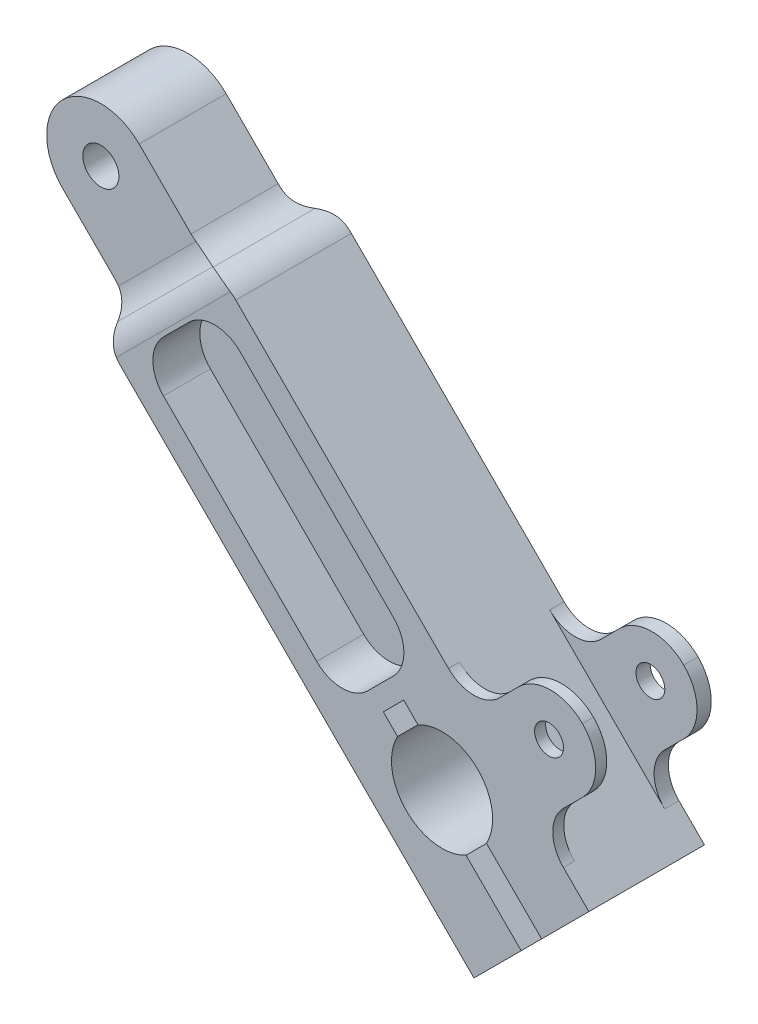
from build123d import *

# Parameters (mm, degrees)
BOSS_EXTRUDE1_DEPTH    = 38
SKETCH2_3_R            = 3.9999999999999627
BOSS_EXTRUDE2_DEPTH    = 6.5
FILLET1_R              = 12.5
FILLET1_OF_MIRROR1_R   = 12.5
BOSS_EXTRUDE3_DEPTH    = 45
SKETCH4_R              = 5.000000000000005
CUT_EXTRUDE1_DEPTH     = 231.17837570940728
CUT_EXTRUDE8_START     = -0.897
CUT_EXTRUDE8_DEPTH     = 0.897
FILLET2_R              = 15
FILLET3_R              = 10
SKETCH8_R              = 3.9999999999999964
SKETCH8_R_2            = 4
CUT_EXTRUDE4_DEPTH     = 10
CUT_EXTRUDE5_START     = -2.5515
CUT_EXTRUDE5_OUTLINE_R = 4
CUT_EXTRUDE5_DEPTH     = 2.5515
CUT_EXTRUDE6_START     = -3.4485
CUT_EXTRUDE6_OUTLINE_R = 4
CUT_EXTRUDE6_DEPTH     = 3.4485
CUT_EXTRUDE7_DEPTH     = 13
FILLET4_R              = 10
FILLET6_R              = 10
FILLET7_R              = 10
FILLET4_OF_MIRROR2_R   = 10
THREAD1_PITCH          = 1
THREAD2_PITCH          = 1


with BuildPart() as part:
    # Sketch2 → Boss-Extrude1 (new body)
    with BuildSketch(Plane.XY):
        with BuildLine():
            ThreePointArc((131.93651427858003, -126.27966002908764), (129.52074910994037, -109.72175923671702), (112.96284831756975, -107.30599406807737))
            Line((112.96284831756975, -107.30599406807737), (109.01465245553005, -103.35779820603764))
            Line((109.01465245553005, -103.35779820603764), (103.35779820603757, -109.01465245552998))
            Line((103.35779820603757, -109.01465245552998), (107.30599406807737, -112.96284831756975))
            ThreePointArc((107.30599406807737, -112.96284831756975), (109.72175923671703, -129.52074910994037), (126.27966002908764, -131.93651427858003))
            Line((126.27966002908764, -131.93651427858003), (141.5415643901112, -147.1984186396036))
            Line((141.5415643901112, -147.1984186396036), (128.46008893816008, -160.27989409155472))
            Line((128.46008893816008, -160.27989409155472), (114.31795331442913, -146.13775846782377))
            Line((114.31795331442913, -146.13775846782377), (26.51650429449548, -58.336309447890216))
            Line((26.51650429449548, -58.336309447890216), (31.819805153394636, -53.03300858899105))
            Line((31.819805153394636, -53.03300858899105), (53.03300858899106, -31.819805153394636))
            Line((53.03300858899106, -31.819805153394636), (58.3363094478902, -26.516504294495466))
            Line((58.3363094478902, -26.516504294495466), (128.4600889381601, -96.64028378476549))
            Line((128.4600889381601, -96.64028378476549), (146.13775846782377, -114.31795331442913))
            Line((146.13775846782377, -114.31795331442913), (160.27989409155475, -128.46008893816008))
            Line((160.27989409155475, -128.46008893816008), (147.1984186396036, -141.5415643901112))
            Line((147.1984186396036, -141.5415643901112), (131.93651427858003, -126.27966002908764))
        make_face()
    extrude(amount=BOSS_EXTRUDE1_DEPTH)

    # Sketch2<3> → Boss-Extrude2 (add)
    with BuildSketch(Plane.XY):
        Polygon((149.67329237375654, -75.42708034916903), (128.4600889381601, -96.64028378476549), (146.13775846782377, -114.31795331442913), (167.35096190342023, -93.10474987883272), align=None)
        with Locations(Location((149.25239548019323, -92.68385298526943, 0), (0, 0, 180))):
            Circle(SKETCH2_3_R, mode=Mode.SUBTRACT)
    boss_extrude2 = extrude(amount=BOSS_EXTRUDE2_DEPTH)

    # Fillet1
    fillet1_edges = [part.edges().sort_by_distance(p)[0] for p in [
        (167.35096190342023, -93.10474987883272, 3.25),
        (149.67329237375654, -75.42708034916903, 3.25),
    ]]
    fillet(fillet1_edges, radius=FILLET1_R - 0.0001)  # a hair under: the kernel refuses the full size

    # Mirror1: Boss-Extrude2 across plane
    add(boss_extrude2.mirror(Plane(origin=(0, 0, 19), x_dir=(1, 0, 0), z_dir=(0, 0, -1))))

    # Fillet1 of Mirror1
    fillet1_of_mirror1_edges = [part.edges().sort_by_distance(p)[0] for p in [
        (167.35096190342023, -93.10474987883272, 34.75),
        (149.67329237375654, -75.42708034916903, 34.75),
    ]]
    fillet(fillet1_of_mirror1_edges, radius=FILLET1_OF_MIRROR1_R - 0.0001)  # a hair under: the kernel refuses the full size

    # Sketch3 → Boss-Extrude3 (add)
    with BuildSketch(Plane(origin=(42.42640687119298, -42.426406871192754, 0), x_dir=(0, 0, 1), z_dir=(-0.7071067811865493, 0.7071067811865457, 0))):
        Polygon((6.499999999999996, 14.99999999999999), (31.499999999999993, 14.99999999999999), (31.5, -15.00000000000001), (6.499999999999999, -15.00000000000001), align=None)
    extrude(amount=BOSS_EXTRUDE3_DEPTH)

    # Sketch4 → Cut-Extrude1 (cut, through all)
    with BuildSketch(Plane.XY.offset(31.499999999999993)):
        with Locations((21.213203435596462, -21.213203435596423)):
            Circle(SKETCH4_R)
    extrude(amount=-CUT_EXTRUDE1_DEPTH, mode=Mode.SUBTRACT)

    # Sketch12 → Cut-Extrude8 (cut)
    with BuildSketch(Plane.XY.offset(31.499999999999993).offset(CUT_EXTRUDE8_START)):
        Polygon((31.819805153394782, -53.03300858899101), (53.033008588991144, -31.819805153394533), (21.21320343559643, 2.26e-14), (6.424e-14, -21.21320343559645), align=None)
    extrude(amount=CUT_EXTRUDE8_DEPTH, mode=Mode.SUBTRACT)

    # Fillet2
    fillet2_edges = [part.edges().sort_by_distance(p)[0] for p in [
        (21.213203435596437, 3.375e-14, 18.551499999999994),
        (6.75e-14, -21.213203435596448, 18.551499999999997),
    ]]
    fillet(fillet2_edges, radius=FILLET2_R - 0.0001)  # a hair under: the kernel refuses the full size

    # Fillet3
    fillet3_edges = [part.edges().sort_by_distance(p)[0] for p in [
        (128.4600889381601, -96.64028378476549, 3.25),
        (146.13775846782377, -114.31795331442913, 3.25),
        (128.4600889381601, -96.64028378476549, 34.75),
        (146.13775846782377, -114.31795331442913, 34.75),
    ]]
    fillet(fillet3_edges, radius=FILLET3_R)

    # Sketch8 → Cut-Extrude4 (cut)
    with BuildSketch(Plane(origin=(-15.909902576697377, -15.909902576697391, 0), x_dir=(0, 0, 1), z_dir=(-0.7071067811865472, -0.7071067811865479, 0))):
        with Locations(Location((20.591500000000007, -151.0189999999996, 0), (0, 0, 270))):
            Circle(SKETCH8_R)
        with Locations(Location((20.591500000000003, -192.16999999999985, 0), (0, 0, 270))):
            Circle(SKETCH8_R_2)
    extrude(amount=-CUT_EXTRUDE4_DEPTH, mode=Mode.SUBTRACT)

    # Cut-Extrude5: read off the stored shape, not the designer's step
    # Cut-Extrude5 outline → Cut-Extrude5 (cut)
    with BuildSketch(Plane(origin=(0, 0, 0), x_dir=(-1, 0, 0), z_dir=(0, 0, -1)).offset(CUT_EXTRUDE5_START)):
        Polygon((-184.134167706, -104.605815324), (-128.460088938, -160.279894092), (-26.516504294, -58.336309448), (-82.190583062, -2.66223068), align=None)
        with Locations((-149.25239548, -92.683852985)):
            Circle(CUT_EXTRUDE5_OUTLINE_R, mode=Mode.SUBTRACT)
    extrude(amount=CUT_EXTRUDE5_DEPTH, mode=Mode.SUBTRACT)

    # Cut-Extrude6: read off the stored shape, not the designer's step
    # Cut-Extrude6 outline → Cut-Extrude6 (cut)
    with BuildSketch(Plane.XY.offset(38).offset(CUT_EXTRUDE6_START)):
        Polygon((26.516504294, -58.336309448), (128.460088938, -160.279894092), (184.009996871, -104.729986159), (82.066412227, -2.786401515), align=None)
        with Locations((149.25239548, -92.683852985)):
            Circle(CUT_EXTRUDE6_OUTLINE_R, mode=Mode.SUBTRACT)
    extrude(amount=CUT_EXTRUDE6_DEPTH, mode=Mode.SUBTRACT)

    # Sketch11 → Cut-Extrude7 (cut)
    with BuildSketch(Plane(origin=(0, 0, 2.551500000000005), x_dir=(-1, 0, -2e-17), z_dir=(2e-17, -1.3e-16, -1))):
        Polygon((-113.19718906624851, -91.98398563065189), (-102.59058734845024, -102.59058734845023), (-99.0550534425175, -99.05505344251749), (-109.66165516031576, -88.44845172471916), align=None)
        Polygon((-99.0550534425175, -99.05505344251749), (-102.59058734845024, -102.59058734845023), (-91.98398563065216, -113.19718906624838), (-88.44845172471943, -109.66165516031565), align=None)
        Polygon((-109.66165516031576, -88.44845172471916), (-99.0550534425175, -99.05505344251749), (-74.30631610098834, -74.30631610098833), (-49.557578759459176, -49.557578759459176), (-60.164180477257275, -38.950977041661005), align=None)
        Polygon((-74.30631610098834, -74.30631610098833), (-99.0550534425175, -99.05505344251749), (-88.44845172471943, -109.66165516031565), (-63.699714383190155, -84.91291781878655), align=None)
        Polygon((-49.557578759459176, -49.557578759459176), (-74.30631610098834, -74.30631610098833), (-63.69971438319015, -84.91291781878657), (-38.950977041660906, -60.164180477257496), align=None)
        Polygon((-60.164180477257275, -38.950977041661005), (-49.55757875945917, -49.557578759459176), (-46.02204485352645, -46.022044853526445), (-56.62864657132452, -35.415443135728296), align=None)
        Polygon((-46.02204485352645, -46.022044853526445), (-49.557578759459176, -49.557578759459176), (-38.950977041660906, -60.164180477257496), (-35.41544313572817, -56.62864657132479), align=None)
    cut_extrude7 = extrude(amount=-CUT_EXTRUDE7_DEPTH, mode=Mode.SUBTRACT)

    # Fillet4
    fillet4_edges = [part.edges().sort_by_distance(p)[0] for p in [
        (35.41544313572817, -56.62864657132479, 9.051500000000013),
        (91.98398563065216, -113.19718906624838, 9.051500000000022),
        (113.19718906624851, -91.98398563065189, 9.051500000000019),
        (56.62864657132452, -35.415443135728296, 9.051500000000011),
    ]]
    fillet(fillet4_edges, radius=FILLET4_R)

    # Fillet6
    # the kernel refuses this fillet: 10 mm, written as the material it adds along each edge
    with BuildSketch(Plane(origin=(53.03300858899116, -31.81980515339452, 6.4999999999999964), x_dir=(0.7071067811865468, 0.7071067811865482, 0), z_dir=(0, 0, 1))) as fillet6_piece_1:
        with BuildLine():
            CenterArc((9.999999999999986, 9.682458365518524), FILLET6_R, 180.00000000000014, 75.52248781406956)
            Line((-1.534e-14, 9.682458365518503), (-0.2000000000000149, 9.682458365518503))
            Line((-0.2000000000000149, 9.682458365518503), (-0.1999999999999996, 2.1e-16))
            Line((-0.1999999999999996, 2.1e-16), (-2e-16, -0.1999999999999996))
            ThreePointArc((-2e-16, -0.1999999999999996), (3.749999999999965, -0.19999999999998838), (7.449999999999917, -0.19364916731037407))
            Line((7.449999999999917, -0.19364916731037407), (7.499999999999917, -1.1e-16))
        make_face()
    extrude(amount=24.102999999999998)
    with BuildSketch(Plane(origin=(31.819805153394785, -53.033008588991, 30.602999999999994), x_dir=(-4.884542673953227e-11, 4.884542673953201e-11, 1.0), z_dir=(0.7071067811865457, 0.7071067811865495, 0))) as fillet6_piece_2:
        with BuildLine():
            CenterArc((10.000000000549937, -7.96111472994481), FILLET6_R, 127.2396365377071, 52.76036346625074)
            Line((5.4993681e-10, -7.961114730635589), (-0.19999999945006247, -7.961114730649404))
            Line((-0.19999999945006247, -7.961114730649404), (-0.1999999999999993, -1.381557e-11))
            Line((-0.1999999999999993, -1.381557e-11), (-1.381557e-11, 0.19999999999999962))
            ThreePointArc((-1.381557e-11, 0.19999999999999962), (1.9742499999861822, 0.2000000001363364), (3.8274699999890065, 0.1592222945988919))
            Line((3.8274699999890065, 0.1592222945988919), (3.948500000000003, 0))
        make_face()
    extrude(amount=30)
    with BuildSketch(Plane(origin=(31.81980515339479, -53.033008588991, 6.499999999999999), x_dir=(-4.884461071493019e-11, 4.884444323840101e-11, -1.0), z_dir=(0.7071067811865457, 0.7071067811865493, 0))) as fillet6_piece_3:
        with BuildLine():
            CenterArc((10.000000000549926, 7.961114729944808), FILLET6_R, 179.99999999604222, 52.76036346625068)
            Line((5.4992668e-10, 7.961114730635574), (-0.1999999994500735, 7.961114730649389))
            Line((-0.1999999994500735, 7.961114730649389), (-0.20000000000000018, 1.381532e-11))
            Line((-0.20000000000000018, 1.381532e-11), (-1.381532e-11, -0.1999999999999996))
            ThreePointArc((-1.381532e-11, -0.1999999999999996), (1.9742499999861833, -0.20000000013633387), (3.827469999988999, -0.15922229459889203))
            Line((3.827469999988999, -0.15922229459889203), (3.9484999999999975, 0))
        make_face()
    extrude(amount=30)
    with BuildSketch(Plane(origin=(31.81980515339479, -53.033008588991, 30.602999999999994), x_dir=(-0.7071067811865537, -0.7071067811865414, 0), z_dir=(0, 0, -1))) as fillet6_piece_4:
        with BuildLine():
            CenterArc((10.000000000000112, 9.68245836551857), FILLET6_R, 179.99999999999937, 75.52248781407133)
            Line((1.0969e-13, 9.682458365518684), (-0.19999999999988977, 9.682458365518686))
            Line((-0.19999999999988977, 9.682458365518686), (-0.1999999999999996, 1.74e-15))
            Line((-0.1999999999999996, 1.74e-15), (-1.74e-15, -0.19999999999999962))
            ThreePointArc((-1.74e-15, -0.19999999999999962), (3.7500000000001013, -0.1999999999999594), (7.450000000000217, -0.19364916731037085))
            Line((7.450000000000217, -0.19364916731037085), (7.500000000000217, -2.3e-16))
        make_face()
    extrude(amount=24.102999999999994)
    with BuildSketch(Plane(origin=(31.81980515339479, -53.033008588991, 6.499999999999999), x_dir=(-4.884461071493019e-11, 4.884444323840101e-11, -1.0), z_dir=(0.7071067811865457, 0.7071067811865493, 0))) as fillet6_piece_5a_section:
        with BuildLine():
            CenterArc((10.000000000549926, 7.961114729944808), FILLET6_R, 179.99999999604222, 52.76036346625068)
            Line((5.4992668e-10, 7.961114730635574), (-0.1999999994500735, 7.961114730649389))
            Line((-0.1999999994500735, 7.961114730649389), (-0.20000000000000018, 1.381532e-11))
            Line((-0.20000000000000018, 1.381532e-11), (-1.381532e-11, -0.1999999999999996))
            ThreePointArc((-1.381532e-11, -0.1999999999999996), (1.9742499999861833, -0.20000000013633387), (3.827469999988999, -0.15922229459889203))
            Line((3.827469999988999, -0.15922229459889203), (3.9484999999999975, 0))
        make_face()
    fillet6_piece_5a = extrude(amount=49.90278682658893, mode=Mode.PRIVATE)
    fillet6_piece_5a = split(fillet6_piece_5a, bisect_by=Plane(origin=(58.33630944789017, -26.5165042944956, 6.499999999999999), z_dir=(-0.7071067811865472, -0.7071067811865478, 0)), keep=Keep.TOP, mode=Mode.PRIVATE)
    fillet6_piece_5a = split(fillet6_piece_5a, bisect_by=Plane(origin=(53.03300858899116, -31.819805153394523, 6.499999999999999), z_dir=(0.7071067811865457, 0.7071067811865493, 0)), keep=Keep.TOP, mode=Mode.PRIVATE)
    with BuildSketch(Plane(origin=(53.03300858899116, -31.81980515339452, -17.706145913796266), x_dir=(0.7071067811865468, 0.7071067811865482, 0), z_dir=(0, 0, 1))) as fillet6_piece_5b_section:
        with BuildLine():
            CenterArc((9.999999999999986, 9.682458365518524), FILLET6_R, 180.00000000000014, 75.52248781406956)
            Line((-1.534e-14, 9.682458365518503), (-0.2000000000000149, 9.682458365518503))
            Line((-0.2000000000000149, 9.682458365518503), (-0.1999999999999996, 2.1e-16))
            Line((-0.1999999999999996, 2.1e-16), (-2e-16, -0.1999999999999996))
            ThreePointArc((-2e-16, -0.1999999999999996), (3.749999999999965, -0.19999999999998838), (7.449999999999917, -0.19364916731037407))
            Line((7.449999999999917, -0.19364916731037407), (7.499999999999917, -1.1e-16))
        make_face()
    fillet6_piece_5b = extrude(amount=48.30914591379626, mode=Mode.PRIVATE)
    fillet6_piece_5b = split(fillet6_piece_5b, bisect_by=Plane(origin=(53.03300858899116, -31.81980515339452, 2.5515000000000008), z_dir=(0, 0, 1)), keep=Keep.TOP, mode=Mode.PRIVATE)
    fillet6_piece_5b = split(fillet6_piece_5b, bisect_by=Plane(origin=(53.03300858899116, -31.819805153394515, 6.4999999999999964), z_dir=(-8e-17, -8e-17, -1)), keep=Keep.TOP, mode=Mode.PRIVATE)
    fillet6_piece_5 = fillet6_piece_5a & fillet6_piece_5b
    add(fillet6_piece_5)
    with BuildSketch(Plane(origin=(53.03300858899116, -31.81980515339452, 6.4999999999999964), x_dir=(0.7071067811865468, 0.7071067811865482, 0), z_dir=(0, 0, 1))) as fillet6_piece_6a_section:
        with BuildLine():
            CenterArc((9.999999999999986, 9.682458365518524), FILLET6_R, 180.00000000000014, 75.52248781406956)
            Line((-1.534e-14, 9.682458365518503), (-0.2000000000000149, 9.682458365518503))
            Line((-0.2000000000000149, 9.682458365518503), (-0.1999999999999996, 2.1e-16))
            Line((-0.1999999999999996, 2.1e-16), (-2e-16, -0.1999999999999996))
            ThreePointArc((-2e-16, -0.1999999999999996), (3.749999999999965, -0.19999999999998838), (7.449999999999917, -0.19364916731037407))
            Line((7.449999999999917, -0.19364916731037407), (7.499999999999917, -1.1e-16))
        make_face()
    fillet6_piece_6a = extrude(amount=48.30914591379626, mode=Mode.PRIVATE)
    fillet6_piece_6a = split(fillet6_piece_6a, bisect_by=Plane(origin=(53.03300858899116, -31.81980515339452, 34.5515), z_dir=(0, 0, -1)), keep=Keep.TOP, mode=Mode.PRIVATE)
    fillet6_piece_6a = split(fillet6_piece_6a, bisect_by=Plane(origin=(53.03300858899116, -31.81980515339452, 30.602999999999994), z_dir=(0, 0, 1)), keep=Keep.TOP, mode=Mode.PRIVATE)
    with BuildSketch(Plane(origin=(31.819805153394785, -53.033008588991, 30.602999999999994), x_dir=(-4.884542673953227e-11, 4.884542673953201e-11, 1.0), z_dir=(0.7071067811865457, 0.7071067811865495, 0))) as fillet6_piece_6b_section:
        with BuildLine():
            CenterArc((10.000000000549937, -7.96111472994481), FILLET6_R, 127.2396365377071, 52.76036346625074)
            Line((5.4993681e-10, -7.961114730635589), (-0.19999999945006247, -7.961114730649404))
            Line((-0.19999999945006247, -7.961114730649404), (-0.1999999999999993, -1.381557e-11))
            Line((-0.1999999999999993, -1.381557e-11), (-1.381557e-11, 0.19999999999999962))
            ThreePointArc((-1.381557e-11, 0.19999999999999962), (1.9742499999861822, 0.2000000001363364), (3.8274699999890065, 0.1592222945988919))
            Line((3.8274699999890065, 0.1592222945988919), (3.948500000000003, 0))
        make_face()
    fillet6_piece_6b = extrude(amount=49.90278682658897, mode=Mode.PRIVATE)
    fillet6_piece_6b = split(fillet6_piece_6b, bisect_by=Plane(origin=(58.336309447890166, -26.5165042944956, 30.602999999999994), z_dir=(-0.7071067811865472, -0.7071067811865478, 0)), keep=Keep.TOP, mode=Mode.PRIVATE)
    fillet6_piece_6b = split(fillet6_piece_6b, bisect_by=Plane(origin=(53.03300858899116, -31.81980515339452, 30.602999999999994), z_dir=(0.7071067811865457, 0.7071067811865493, 0)), keep=Keep.TOP, mode=Mode.PRIVATE)
    fillet6_piece_6 = fillet6_piece_6a & fillet6_piece_6b
    add(fillet6_piece_6)
    with BuildSketch(Plane(origin=(31.81980515339479, -53.033008588991, 54.80914591379671), x_dir=(-0.7071067811865537, -0.7071067811865414, 0), z_dir=(0, 0, -1))) as fillet6_piece_7a_section:
        with BuildLine():
            CenterArc((10.000000000000112, 9.68245836551857), FILLET6_R, 179.99999999999937, 75.52248781407133)
            Line((1.0969e-13, 9.682458365518684), (-0.19999999999988977, 9.682458365518686))
            Line((-0.19999999999988977, 9.682458365518686), (-0.1999999999999996, 1.74e-15))
            Line((-0.1999999999999996, 1.74e-15), (-1.74e-15, -0.19999999999999962))
            ThreePointArc((-1.74e-15, -0.19999999999999962), (3.7500000000001013, -0.1999999999999594), (7.450000000000217, -0.19364916731037085))
            Line((7.450000000000217, -0.19364916731037085), (7.500000000000217, -2.3e-16))
        make_face()
    fillet6_piece_7a = extrude(amount=48.30914591379671, mode=Mode.PRIVATE)
    fillet6_piece_7a = split(fillet6_piece_7a, bisect_by=Plane(origin=(31.81980515339479, -53.033008588991, 34.5515), z_dir=(0, 0, -1)), keep=Keep.TOP, mode=Mode.PRIVATE)
    fillet6_piece_7a = split(fillet6_piece_7a, bisect_by=Plane(origin=(31.81980515339479, -53.033008588991, 30.602999999999994), z_dir=(0, 0, 1)), keep=Keep.TOP, mode=Mode.PRIVATE)
    with BuildSketch(Plane(origin=(17.746409623803473, -67.10640411858239, 30.602999999999994), x_dir=(-4.8844526976665667e-11, 4.88445269766654e-11, 1.0), z_dir=(0.7071067811865457, 0.7071067811865495, 0))) as fillet6_piece_7b_section:
        with BuildLine():
            CenterArc((10.000000000549926, -7.961114729944823), FILLET6_R, 127.23963653770703, 52.76036346625074)
            Line((5.4992668e-10, -7.961114730635589), (-0.1999999994500726, -7.961114730649404))
            Line((-0.1999999994500726, -7.961114730649404), (-0.1999999999999993, -1.381532e-11))
            Line((-0.1999999999999993, -1.381532e-11), (-1.381532e-11, 0.1999999999999946))
            ThreePointArc((-1.381532e-11, 0.1999999999999946), (1.9742499999861824, 0.20000000013632888), (3.827469999989007, 0.15922229459888704))
            Line((3.827469999989007, 0.15922229459888704), (3.948500000000003, 0))
        make_face()
    fillet6_piece_7b = extrude(amount=49.90278682658897, mode=Mode.PRIVATE)
    fillet6_piece_7b = split(fillet6_piece_7b, bisect_by=Plane(origin=(26.51650429449561, -58.33630944789025, 30.602999999999994), z_dir=(0.7071067811865476, 0.7071067811865476, 0)), keep=Keep.TOP, mode=Mode.PRIVATE)
    fillet6_piece_7b = split(fillet6_piece_7b, bisect_by=Plane(origin=(31.81980515339479, -53.033008588990995, 30.602999999999994), z_dir=(-0.7071067811865457, -0.7071067811865493, 0)), keep=Keep.TOP, mode=Mode.PRIVATE)
    fillet6_piece_7 = fillet6_piece_7a & fillet6_piece_7b
    add(fillet6_piece_7)
    with BuildSketch(Plane(origin=(17.746409623803505, -67.10640411858236, 6.500000000000002), x_dir=(-4.884371095206358e-11, 4.8843543475534404e-11, -1.0), z_dir=(0.7071067811865457, 0.7071067811865493, 0))) as fillet6_piece_8a_section:
        with BuildLine():
            CenterArc((10.000000000549916, 7.96111472994482), FILLET6_R, 179.99999999604228, 52.76036346625074)
            Line((5.4991655e-10, 7.961114730635574), (-0.19999999945008362, 7.961114730649388))
            Line((-0.19999999945008362, 7.961114730649388), (-0.20000000000000018, 1.382009e-11))
            Line((-0.20000000000000018, 1.382009e-11), (-1.381506e-11, -0.1999999999999996))
            ThreePointArc((-1.381506e-11, -0.1999999999999996), (1.9742499999861836, -0.20000000013632632), (3.827469999988999, -0.15922229459888715))
            Line((3.827469999988999, -0.15922229459888715), (3.9484999999999975, 0))
        make_face()
    fillet6_piece_8a = extrude(amount=49.90278682658893, mode=Mode.PRIVATE)
    fillet6_piece_8a = split(fillet6_piece_8a, bisect_by=Plane(origin=(26.51650429449561, -58.33630944789025, 6.500000000000002), z_dir=(0.7071067811865476, 0.7071067811865476, 0)), keep=Keep.TOP, mode=Mode.PRIVATE)
    fillet6_piece_8a = split(fillet6_piece_8a, bisect_by=Plane(origin=(31.81980515339479, -53.033008588991, 6.500000000000002), z_dir=(-0.7071067811865457, -0.7071067811865493, 0)), keep=Keep.TOP, mode=Mode.PRIVATE)
    with BuildSketch(Plane(origin=(31.81980515339479, -53.033008588991, 30.602999999999994), x_dir=(-0.7071067811865537, -0.7071067811865414, 0), z_dir=(0, 0, -1))) as fillet6_piece_8b_section:
        with BuildLine():
            CenterArc((10.000000000000112, 9.68245836551857), FILLET6_R, 179.99999999999937, 75.52248781407133)
            Line((1.0969e-13, 9.682458365518684), (-0.19999999999988977, 9.682458365518686))
            Line((-0.19999999999988977, 9.682458365518686), (-0.1999999999999996, 1.74e-15))
            Line((-0.1999999999999996, 1.74e-15), (-1.74e-15, -0.19999999999999962))
            ThreePointArc((-1.74e-15, -0.19999999999999962), (3.7500000000001013, -0.1999999999999594), (7.450000000000217, -0.19364916731037085))
            Line((7.450000000000217, -0.19364916731037085), (7.500000000000217, -2.3e-16))
        make_face()
    fillet6_piece_8b = extrude(amount=48.309145913796705, mode=Mode.PRIVATE)
    fillet6_piece_8b = split(fillet6_piece_8b, bisect_by=Plane(origin=(31.81980515339479, -53.033008588991, 2.5515000000000008), z_dir=(0, 0, 1)), keep=Keep.TOP, mode=Mode.PRIVATE)
    fillet6_piece_8b = split(fillet6_piece_8b, bisect_by=Plane(origin=(31.819805153394785, -53.033008588991, 6.5), z_dir=(-8e-17, -8e-17, -1)), keep=Keep.TOP, mode=Mode.PRIVATE)
    fillet6_piece_8 = fillet6_piece_8a & fillet6_piece_8b
    add(fillet6_piece_8)

    # Fillet7
    # the kernel refuses this fillet: 10 mm, written as the material it takes off along each edge
    with BuildSketch(Plane(origin=(58.336309447889946, -26.516504294495732, 30.603), x_dir=(-0.9487649433019302, -0.31598272478299405, 2.1830576303831723e-12), z_dir=(-3.4481643626552008e-12, 3.444618171435251e-12, -1.0))) as fillet7_piece_1:
        with BuildLine():
            CenterArc((6.289753671254109, -9.777746836288735), FILLET7_R, 102.10233763461153, 51.31781254651193)
            Line((-2.6533628546731527, -5.303300858998716), (-2.832225185191697, -5.213811939452914))
            Line((-2.832225185191697, -5.213811939452914), (-0.1788623305185442, 0.08948891954580131))
            Line((-0.1788623305185442, 0.08948891954580131), (0.04193169113777444, 0.19555493672706298))
            ThreePointArc((0.04193169113777444, 0.19555493672706298), (2.0965845570326387, -0.02225316371127039), (4.151237422920756, 0.19555493672577454))
            Line((4.151237422920756, 0.19555493672577454), (4.193169114064546, -6e-17))
        make_face()
    extrude(amount=42.87659157636469, mode=Mode.SUBTRACT)
    with BuildSketch(Plane(origin=(26.516504294495732, -58.336309447889946, 6.5), x_dir=(0.7071067811865074, -0.7071067811865877, 4.886381395542499e-12), z_dir=(-3.4533569997986987e-12, 3.457029840705075e-12, 1.0))) as fillet7_piece_2:
        with BuildLine():
            CenterArc((5.930036630545515, 10), FILLET7_R, 218.6821874534914, 51.317812546511846)
            Line((-1.8762108674522682, 3.7499999999997327), (-2.032335817412224, 3.624999999999728))
            ThreePointArc((-2.032335817412224, 3.624999999999728), (-0.9182041701122168, 1.8849570578852004), (-0.19364916731028062, -0.0500000000003425))
            Line((-0.19364916731028062, -0.0500000000003425), (1.136e-14, -0.1999999999999996))
            Line((1.136e-14, -0.1999999999999996), (5.930036630546094, -0.19999999999999965))
            Line((5.930036630546094, -0.19999999999999965), (5.930036630546082, -1.1e-16))
        make_face()
    extrude(amount=42.87659157636522, mode=Mode.SUBTRACT)
    with BuildSketch(Plane(origin=(65.35418490255022, -19.49862883969329, 2.5514999999999852), x_dir=(-0.5026820524064812, 0.5026820524101471, 0.703293330249285), z_dir=(-0.7071067811891263, -0.7071067811839689, 0))) as fillet7_piece_3:
        with BuildLine():
            CenterArc((4.210725272788522, -9.901008886193663), FILLET7_R, 98.06853427806948, 36.62329490815952)
            Line((-2.8222080297046035, -2.792011125420127), (-2.962866695754471, -2.6498311702046617))
            Line((-2.962866695754471, -2.6498311702046617), (-0.14065866604985355, 0.14217995521547983))
            Line((-0.14065866604985355, 0.14217995521547983), (0.02807150182361814, 0.19802017772279396))
            ThreePointArc((0.02807150182361814, 0.19802017772279396), (1.4035750909962508, 0.10100888619365414), (2.7790786801725353, 0.19802017772386987))
            Line((2.7790786801725353, 0.19802017772386987), (2.8071501819885376, -6e-17))
        make_face()
    extrude(amount=47.424774647125744, mode=Mode.SUBTRACT)
    with BuildSketch(Plane(origin=(31.819805153201457, -53.033008588797465, 34.55150000000004), x_dir=(-0.502682052406571, 0.502682052410237, -0.7032933302491564), z_dir=(0.7071067811891263, 0.7071067811839687, 0))) as fillet7_piece_4:
        with BuildLine():
            CenterArc((4.210725272787247, -9.901008886193917), FILLET7_R, 98.06853427805916, 36.62329490815952)
            Line((-2.822208029704596, -2.792011125419113), (-2.9628666957544363, -2.649831170203616))
            Line((-2.9628666957544363, -2.649831170203616), (-0.1406586660498333, 0.1421799552155036))
            Line((-0.1406586660498333, 0.1421799552155036), (0.02807150182365737, 0.19802017772278538))
            ThreePointArc((0.02807150182365737, 0.19802017772278538), (1.403575090996519, 0.10100888619391202), (2.779078680173081, 0.19802017772387362))
            Line((2.779078680173081, 0.19802017772387362), (2.807150181989046, -1.2e-16))
        make_face()
    extrude(amount=47.42477464712394, mode=Mode.SUBTRACT)
    with BuildSketch(Plane(origin=(31.81980515320199, -53.03300858879801, 34.5515), x_dir=(-0.5026820523999831, 0.5026820523999831, -0.7032933302611943), z_dir=(-0.7071067811865476, -0.7071067811865476, 0))) as fillet7_piece_5:
        with BuildLine():
            CenterArc((4.210725272906815, 9.90100888617015), FILLET7_R, 225.30817081281106, 36.62329490815955)
            Line((-2.8222080297054144, 2.7920111255144433), (-2.962866695757662, 2.649831170301329))
            Line((-2.962866695757662, 2.649831170301329), (-0.14065866605224087, -0.14217995521312182))
            Line((-0.14065866605224087, -0.14217995521312182), (0.02807150181949948, -0.1980201777233741))
            ThreePointArc((0.02807150181949948, -0.1980201777233741), (1.4035750909705211, -0.10100888617014338), (2.779078680121639, -0.19802017772339822))
            Line((2.779078680121639, -0.19802017772339822), (2.807150181940957, 1.4e-16))
        make_face()
    extrude(amount=17.424774647722018, mode=Mode.SUBTRACT)
    with BuildSketch(Plane(origin=(19.498628839149077, -65.35418490285092, 2.5515), x_dir=(-0.502682052399894, 0.502682052399894, 0.7032933302613216), z_dir=(0.7071067811865476, 0.7071067811865476, 0))) as fillet7_piece_6:
        with BuildLine():
            CenterArc((4.210725272908081, 9.901008886169892), FILLET7_R, 225.30817081280088, 36.623294908159494)
            Line((-2.822208029705414, 2.7920111255154367), (-2.9628666957576817, 2.649831170302346))
            Line((-2.9628666957576817, 2.649831170302346), (-0.14065866605226443, -0.14217995521309473))
            Line((-0.14065866605226443, -0.14217995521309473), (0.02807150181945359, -0.19802017772338257))
            ThreePointArc((0.02807150181945359, -0.19802017772338257), (1.4035750909702662, -0.10100888616990175), (2.779078680121095, -0.19802017772339514))
            Line((2.779078680121095, -0.19802017772339514), (2.8071501819404507, 2e-17))
        make_face()
    extrude(amount=17.424774647723776, mode=Mode.SUBTRACT)
    with BuildSketch(Plane(origin=(26.51650429449548, -58.336309447890216, -12.273591576193832), x_dir=(0.7071067811865556, -0.7071067811865395, 0), z_dir=(0, 0, 1))) as fillet7_piece_7:
        with BuildLine():
            CenterArc((5.930036630477647, 10), FILLET7_R, 218.6821874534875, 51.317812546511846)
            Line((-1.8762108675205618, 3.750000000000265), (-2.0323358174805257, 3.625000000000271))
            ThreePointArc((-2.0323358174805257, 3.625000000000271), (-0.9182041701736736, 1.8849570578717603), (-0.19364916731037446, -0.04999999999998764))
            Line((-0.19364916731037446, -0.04999999999998764), (-2.27e-15, -0.1999999999999996))
            Line((-2.27e-15, -0.1999999999999996), (5.930036630477531, -0.19999999999999948))
            Line((5.930036630477531, -0.19999999999999948), (5.930036630477534, 2e-16))
        make_face()
    extrude(amount=18.773591576193834, mode=Mode.SUBTRACT)
    with BuildSketch(Plane(origin=(58.3363094478902, -26.516504294495466, 30.603), x_dir=(-0.9487649433065226, -0.3159827247692044, 0), z_dir=(0, 0, 1))) as fillet7_piece_8:
        with BuildLine():
            CenterArc((6.289753671142924, 9.777746836319205), FILLET7_R, 206.57984981970935, 51.3178125465119)
            Line((-2.653362854719292, 5.303300858899197), (-2.832225185236535, 5.213811939350796))
            Line((-2.832225185236535, 5.213811939350796), (-0.17886233051724354, -0.08948891954840094))
            Line((-0.17886233051724354, -0.08948891954840094), (0.04193169114096268, -0.1955549367263815))
            ThreePointArc((0.04193169114096268, -0.1955549367263815), (2.0965845570477346, 0.02225316368080196), (4.151237422954534, -0.1955549367263841))
            Line((4.151237422954534, -0.1955549367263841), (4.193169114095482, 9e-17))
        make_face()
    extrude(amount=18.773591576193773, mode=Mode.SUBTRACT)

    # Mirror2: Cut-Extrude7 across plane
    add(cut_extrude7.mirror(Plane(origin=(0, 0, 18.551500000000004), x_dir=(1, 0, 2e-17), z_dir=(2e-17, -1.3e-16, -1))), mode=Mode.SUBTRACT)

    # Fillet4 of Mirror2
    fillet4_of_mirror2_edges = [part.edges().sort_by_distance(p)[0] for p in [
        (35.41544313572817, -56.628646571324786, 28.05150000000001),
        (91.98398563065216, -113.19718906624838, 28.05150000000002),
        (113.19718906624851, -91.98398563065189, 28.05150000000002),
        (56.62864657132452, -35.41544313572829, 28.051500000000008),
    ]]
    fillet(fillet4_of_mirror2_edges, radius=FILLET4_OF_MIRROR2_R)

    # Thread1: arcs per turn and ends read off the stored shape
    # Thread1: the profile of Thread Profile2 profile screwed along a right-hand helix through 10 turns, 8 arcs to a turn; built about Z, then put on its axis
    thread1_z = Axis((0, 0, 0), (0, 0, 1))
    thread1_corners = [(3.9997, 0, -0.000173205), (4.541265875, 0, 0.312499998), (4.541265875, 0, 0.437499998), (3.9997, 0, 0.750173202)]
    with BuildLine(mode=Mode.PRIVATE) as thread1_profile:
        Line(thread1_corners[0], thread1_corners[1])
        Line(thread1_corners[1], thread1_corners[2])
        Line(thread1_corners[2], thread1_corners[3])
        Line(thread1_corners[3], thread1_corners[0])
    thread1_cap = Face(thread1_profile.wire())
    thread1_turn_angles = [0, 22.5, 45, 67.5, 90, 112.5, 135, 157.5, 180, 202.5, 225, 247.5, 270, 292.5, 315, 337.5, 360]
    thread1_turn_weights = [1, 0.9238795325112867, 1, 0.9238795325112867, 1, 0.9238795325112867, 1, 0.9238795325112867, 1, 0.9238795325112867, 1, 0.9238795325112867, 1, 0.9238795325112867, 1, 0.9238795325112867, 1]
    thread1_turn_rails = [Edge.make_bspline([Vector(p[0], p[1], 0).rotate(thread1_z, thread1_turn_angles[k]) / thread1_turn_weights[k] + Vector(0, 0, p[2] + THREAD1_PITCH * thread1_turn_angles[k] / 360) for k in range(17)], [0, 0, 0, 1, 1, 2, 2, 3, 3, 4, 4, 5, 5, 6, 6, 7, 7, 8, 8, 8], 2, thread1_turn_weights) for p in thread1_corners]
    thread1_turn_sides = [Face.make_surface_from_curves(thread1_turn_rails[p[0]], thread1_turn_rails[p[1]]) for p in [(0, 1), (1, 2), (2, 3), (3, 0)]]
    thread1 = Plane(origin=(119.974807564, -151.794612717, 20.5915), x_dir=(0.707106781, -0.707106781, 0), z_dir=(0.707106781, 0.707106781, 0)) * Solid(Shell([*[p.moved(Location((0, 0, THREAD1_PITCH * i))) for i in range(10) for p in thread1_turn_sides], thread1_cap, thread1_cap.rotate(thread1_z, 3600).moved(Location((0, 0, THREAD1_PITCH * 3600 / 360)))]))
    add(thread1, mode=Mode.SUBTRACT)

    # Thread2: arcs per turn and ends read off the stored shape
    # Thread2: the profile of Thread Profile3 profile screwed along a right-hand helix through 10 turns, 8 arcs to a turn; built about Z, then put on its axis
    thread2_z = Axis((0, 0, 0), (0, 0, 1))
    thread2_corners = [(3.9997, 0, -0.000173205), (4.541265875, 0, 0.312499999), (4.541265875, 0, 0.437499999), (3.9997, 0, 0.750173203)]
    with BuildLine(mode=Mode.PRIVATE) as thread2_profile:
        Line(thread2_corners[0], thread2_corners[1])
        Line(thread2_corners[1], thread2_corners[2])
        Line(thread2_corners[2], thread2_corners[3])
        Line(thread2_corners[3], thread2_corners[0])
    thread2_cap = Face(thread2_profile.wire())
    thread2_turn_angles = [0, 22.5, 45, 67.5, 90, 112.5, 135, 157.5, 180, 202.5, 225, 247.5, 270, 292.5, 315, 337.5, 360]
    thread2_turn_weights = [1, 0.9238795325112867, 1, 0.9238795325112867, 1, 0.9238795325112867, 1, 0.9238795325112867, 1, 0.9238795325112867, 1, 0.9238795325112867, 1, 0.9238795325112867, 1, 0.9238795325112867, 1]
    thread2_turn_rails = [Edge.make_bspline([Vector(p[0], p[1], 0).rotate(thread2_z, thread2_turn_angles[k]) / thread2_turn_weights[k] + Vector(0, 0, p[2] + THREAD2_PITCH * thread2_turn_angles[k] / 360) for k in range(17)], [0, 0, 0, 1, 1, 2, 2, 3, 3, 4, 4, 5, 5, 6, 6, 7, 7, 8, 8, 8], 2, thread2_turn_weights) for p in thread2_corners]
    thread2_turn_sides = [Face.make_surface_from_curves(thread2_turn_rails[p[0]], thread2_turn_rails[p[1]]) for p in [(0, 1), (1, 2), (2, 3), (3, 0)]]
    thread2 = Plane(origin=(90.876656411, -122.696461565, 20.5915), x_dir=(0.707106781, -0.707106781, 0), z_dir=(0.707106781, 0.707106781, 0)) * Solid(Shell([*[p.moved(Location((0, 0, THREAD2_PITCH * i))) for i in range(10) for p in thread2_turn_sides], thread2_cap, thread2_cap.rotate(thread2_z, 3600).moved(Location((0, 0, THREAD2_PITCH * 3600 / 360)))]))
    add(thread2, mode=Mode.SUBTRACT)


solid = part.part
